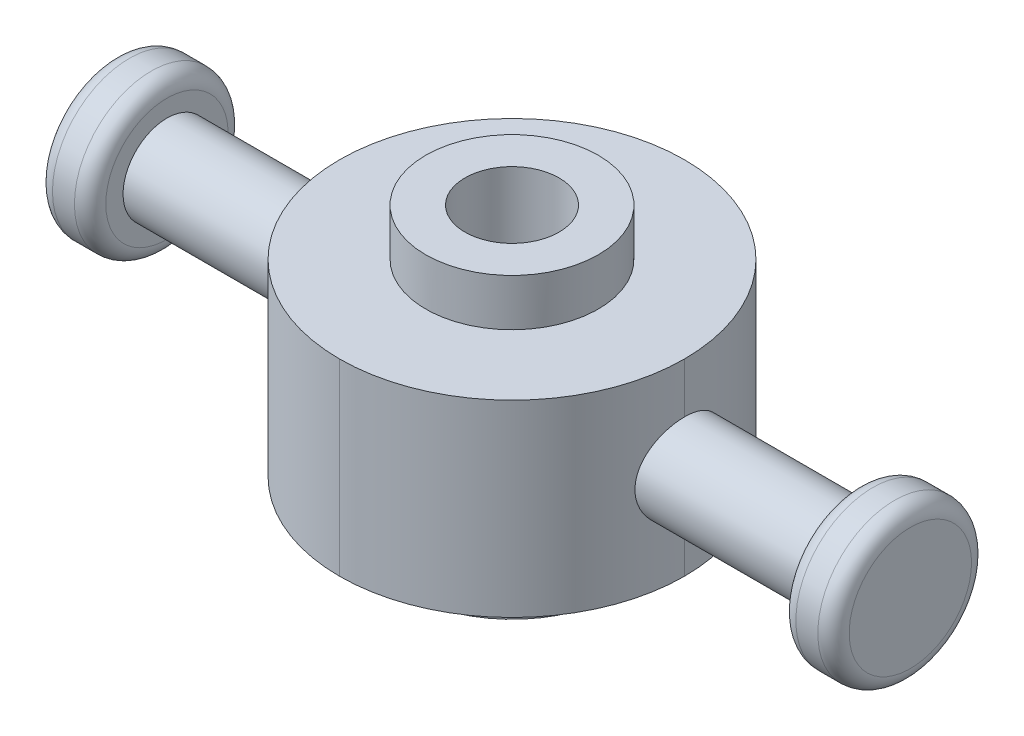
from build123d import *

# Parameters (mm, degrees)
SKETCH1_W      = 11
SKETCH1_H      = 11
EXTRUDE1_DEPTH = 6
SKETCH2_R      = 1.4
EXTRUDE2_DEPTH = 5.5
EXTRUDE3_START = 5.5
SKETCH3_R      = 1.4
EXTRUDE3_DEPTH = 5.5
SKETCH4_R      = 2.75
EXTRUDE4_DEPTH = 1.5
SKETCH5_R      = 3.45
EXTRUDE5_DEPTH = 1.5
SKETCH6_R      = 2.45
EXTRUDE6_DEPTH = 1.7
EXTRUDE7_START = 1.7
SKETCH7_R      = 2.45
EXTRUDE7_DEPTH = 1.7
SKETCH8_R      = 1.5
EXTRUDE8_DEPTH = 24.091989953
FILLET1_R      = 5.5
FILLET3_R      = 0.5


with BuildPart() as part:
    # Sketch1 → Extrude1 (new body)
    with BuildSketch(Plane(origin=(0, 0, 0), x_dir=(1, 0, 0), z_dir=(0, 1, 0))):
        with Locations((5.5, 5.5)):
            Rectangle(SKETCH1_W, SKETCH1_H)
    extrude(amount=EXTRUDE1_DEPTH)

    # Sketch2 → Extrude2 (add)
    with BuildSketch(Plane(origin=(11, 0, 0), x_dir=(0, 0, -1), z_dir=(1, 0, 0))):
        with Locations(Location((5.5, 3, 0), (0, 0, 180))):
            Circle(SKETCH2_R)
    extrude(amount=EXTRUDE2_DEPTH)

    # Sketch3 → Extrude3 (add)
    with BuildSketch(Plane.ZY.offset(EXTRUDE3_START)):
        with Locations((-5.5, 3)):
            Circle(SKETCH3_R)
    extrude(amount=-EXTRUDE3_DEPTH)

    # Sketch4 → Extrude4 (add)
    with BuildSketch(Plane(origin=(0, 6, 0), x_dir=(1, 0, 0), z_dir=(0, 1, 0))):
        with Locations(Location((5.5, 5.5, 0), (0, 0, 90))):
            Circle(SKETCH4_R)
    extrude(amount=EXTRUDE4_DEPTH)

    # Sketch5 → Extrude5 (add)
    with BuildSketch(Plane.XZ):
        with Locations(Location((5.5, -5.5, 0), (0, 0, 270))):
            Circle(SKETCH5_R)
    extrude(amount=EXTRUDE5_DEPTH)

    # Sketch6 → Extrude6 (add)
    with BuildSketch(Plane(origin=(16.5, 0, 0), x_dir=(0, 0, -1), z_dir=(1, 0, 0))):
        with Locations((5.5, 3)):
            Circle(SKETCH6_R)
    extrude(amount=EXTRUDE6_DEPTH)

    # Sketch7 → Extrude7 (add)
    with BuildSketch(Plane.ZY.offset(5.5).offset(EXTRUDE7_START)):
        with Locations(Location((-5.5, 3, 0), (0, 0, 180))):
            Circle(SKETCH7_R)
    extrude(amount=-EXTRUDE7_DEPTH)

    # Sketch8 → Extrude8 (cut, through all)
    with BuildSketch(Plane.XZ.offset(1.5)):
        with Locations(Location((5.5, -5.5, 0), (0, 0, 270))):
            Circle(SKETCH8_R)
    extrude(amount=-EXTRUDE8_DEPTH, mode=Mode.SUBTRACT)

    # Fillet1
    # the kernel refuses this fillet: 5.5 mm, written as the material it takes off along each edge
    with BuildSketch(Plane(origin=(0, -13.75, 0), x_dir=(0, 0, -1), z_dir=(0, 1, 0))) as fillet1_piece_1_section:
        with BuildLine():
            CenterArc((FILLET1_R, -FILLET1_R), FILLET1_R, 90, 90)
            Line((0, -FILLET1_R), (0, 0))
            Line((0, 0), (FILLET1_R, 0))
        make_face()
    fillet1_piece_1 = extrude(amount=33.5, mode=Mode.PRIVATE)
    fillet1_piece_1 = fillet1_piece_1 - Plane(origin=(1.247523626, 3, -5.5), x_dir=(0, 0, 1), z_dir=(-1, 0, 0)) * Cylinder(1.4, 89, mode=Mode.PRIVATE)
    with BuildSketch(Plane(origin=(0, -13.75, -11), x_dir=(0, 0, 1), z_dir=(0, 1, 0))) as fillet1_piece_2_section:
        with BuildLine():
            CenterArc((FILLET1_R, FILLET1_R), FILLET1_R, 180, 90)
            Line((0, FILLET1_R), (0, 0))
            Line((0, 0), (FILLET1_R, 0))
        make_face()
    fillet1_piece_2 = extrude(amount=33.5, mode=Mode.PRIVATE)
    fillet1_piece_2 = fillet1_piece_2 - Plane(origin=(1.247523509, 3, -5.5), x_dir=(0, 0, 1), z_dir=(-1, 0, 0)) * Cylinder(1.4, 89, mode=Mode.PRIVATE)
    with BuildSketch(Plane(origin=(11, -13.75, -11), x_dir=(-1, 0, 0), z_dir=(0, 1, 0))) as fillet1_piece_3_section:
        with BuildLine():
            CenterArc((FILLET1_R, FILLET1_R), FILLET1_R, 180, 90)
            Line((0, FILLET1_R), (0, 0))
            Line((0, 0), (FILLET1_R, 0))
        make_face()
    fillet1_piece_3 = extrude(amount=33.5, mode=Mode.PRIVATE)
    fillet1_piece_3 = fillet1_piece_3 - Plane(origin=(9.752477266, 3, -5.5), x_dir=(0, 0, 1), z_dir=(-1, 0, 0)) * Cylinder(1.4, 89, mode=Mode.PRIVATE)
    with BuildSketch(Plane(origin=(11, -13.75, 0), x_dir=(-1, 0, 0), z_dir=(0, 1, 0))) as fillet1_piece_4_section:
        with BuildLine():
            CenterArc((FILLET1_R, -FILLET1_R), FILLET1_R, 90, 90)
            Line((0, -FILLET1_R), (0, 0))
            Line((0, 0), (FILLET1_R, 0))
        make_face()
    fillet1_piece_4 = extrude(amount=33.5, mode=Mode.PRIVATE)
    fillet1_piece_4 = fillet1_piece_4 - Plane(origin=(9.752475868, 3, -5.5), x_dir=(0, 0, 1), z_dir=(-1, 0, 0)) * Cylinder(1.4, 89, mode=Mode.PRIVATE)
    add([fillet1_piece_1, fillet1_piece_2, fillet1_piece_3, fillet1_piece_4], mode=Mode.SUBTRACT)

    # Fillet3
    fillet3_edges = [part.edges().sort_by_distance(p)[0] for p in [
        (16.5, 3, -3.05),
        (18.2, 3, -3.05),
        (-5.5, 3, -3.05),
        (-7.2, 3, -3.05),
    ]]
    fillet(fillet3_edges, radius=FILLET3_R)


solid = part.part
